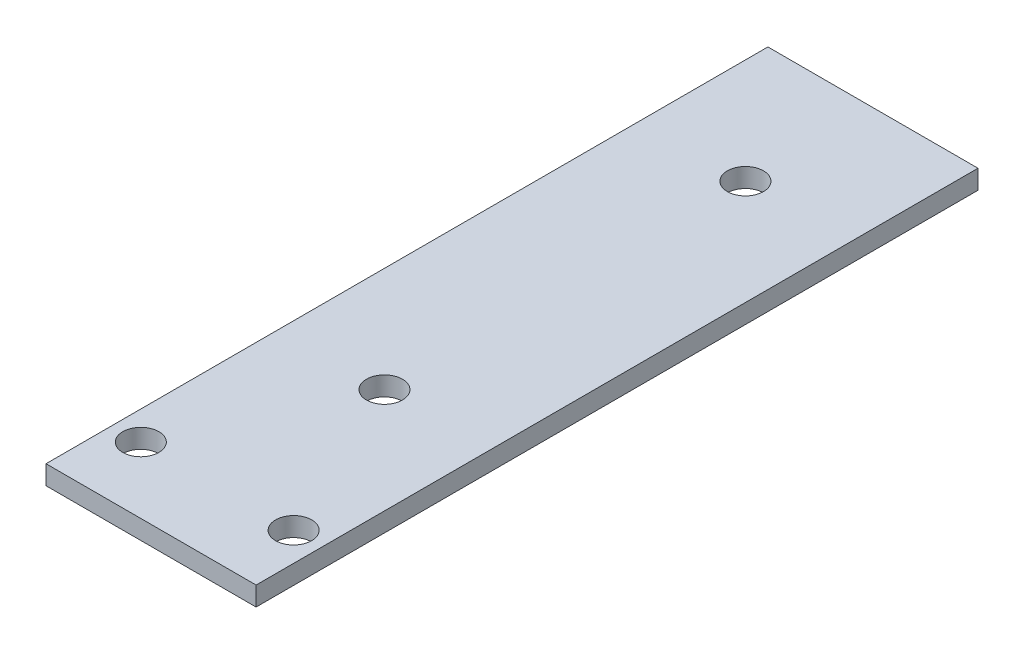
from build123d import *

# Parameters (mm, degrees)
SKETCH1_W           = 38.1
SKETCH1_H           = 120
BOSS_EXTRUDE1_DEPTH = 38.1
SKETCH2_W           = 34.925
SKETCH2_H           = 34.925
CUT_EXTRUDE1_DEPTH  = 130.767142413
SKETCH18_W          = 3.175
SKETCH18_H          = 3.175
CUT_EXTRUDE3_DEPTH  = 130.767142413
SKETCH19_R          = 3
CUT_EXTRUDE4_DEPTH  = 121.228267267


with BuildPart() as part:
    # Sketch1 → Boss-Extrude1 (new body)
    with BuildSketch(Plane.XZ.offset(34.925)):
        with Locations((15.875, -55)):
            Rectangle(SKETCH1_W, SKETCH1_H)
    extrude(amount=-BOSS_EXTRUDE1_DEPTH)

    # Sketch2 → Cut-Extrude1 (cut, through all)
    with BuildSketch(Plane(origin=(0, 0, -115), x_dir=(-1, 0, 0), z_dir=(0, 0, -1))):
        with Locations((-17.4625, -17.4625)):
            Rectangle(SKETCH2_W, SKETCH2_H)
    extrude(amount=-CUT_EXTRUDE1_DEPTH, mode=Mode.SUBTRACT)

    # Sketch18 → Cut-Extrude3 (cut, through all)
    with BuildSketch(Plane.XY.offset(5)):
        with Locations((-1.5875, 1.5875)):
            Rectangle(SKETCH18_W, SKETCH18_H)
    extrude(amount=-CUT_EXTRUDE3_DEPTH, mode=Mode.SUBTRACT)


with BuildPart() as body_2:
    # of the pieces the cut leaves, the one that is kept (cut_extrude3_keep)
    add(part.part.solids().sort_by_distance((34.925, 0, -115))[0])

    # Sketch19 → Cut-Extrude4 (cut, through all)
    with BuildSketch(Plane.XZ):
        with Locations((17.4625, -93.8)):
            Circle(SKETCH19_R)
        with Locations((17.4625, -33.8)):
            Circle(SKETCH19_R)
        with Locations((4.7625, -6)):
            Circle(SKETCH19_R)
        with Locations((30.1625, -6)):
            Circle(SKETCH19_R)
    extrude(amount=-CUT_EXTRUDE4_DEPTH, mode=Mode.SUBTRACT)


solid = body_2.part
